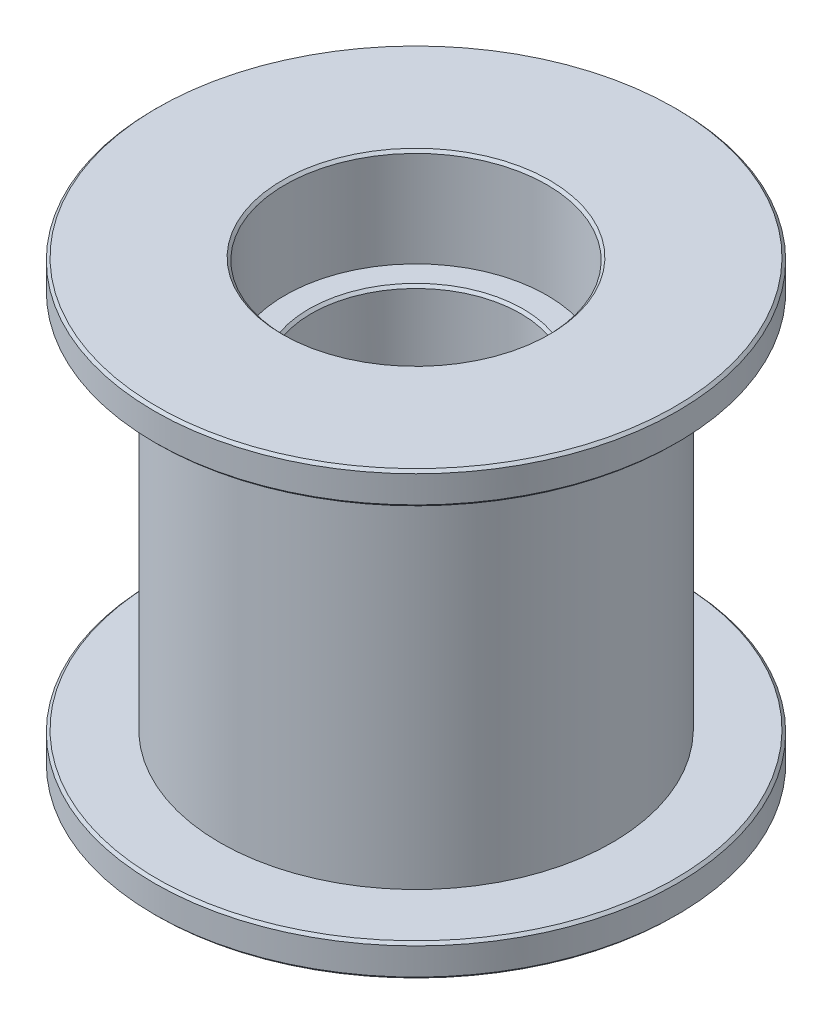
from build123d import *

# Parameters (mm, degrees)
CHAMFER1_SIZE = 0.127


with BuildPart() as part:
    # Sketch1 → Revolve1 (revolve)
    with BuildSketch(Plane.XY):
        Polygon((6.3627, 0), (12.7, 0), (12.7, 1.565625012), (9.525, 1.565625012), (9.525, 19.865624988), (12.7, 19.865624988), (12.7, 21.43125), (6.3627, 21.43125), (6.3627, 16.65605), (5.08, 16.65605), (5.08, 4.7752), (6.3627, 4.7752), align=None)
    revolve(axis=Axis((0, 21.43125, 0), (0, -1, 0)))

    # Chamfer1
    chamfer1_edges = [part.edges().sort_by_distance(p)[0] for p in [
        (-12.7, 19.865624988, 0),
        (-12.7, 1.565625012, 0),
        (-6.3627, 0, 0),
        (-12.7, 0, 0),
        (-5.08, 16.65605, 0),
        (-5.08, 4.7752, 0),
        (-12.7, 21.43125, 0),
        (-6.3627, 21.43125, 0),
    ]]
    chamfer(chamfer1_edges, length=CHAMFER1_SIZE)


solid = part.part
